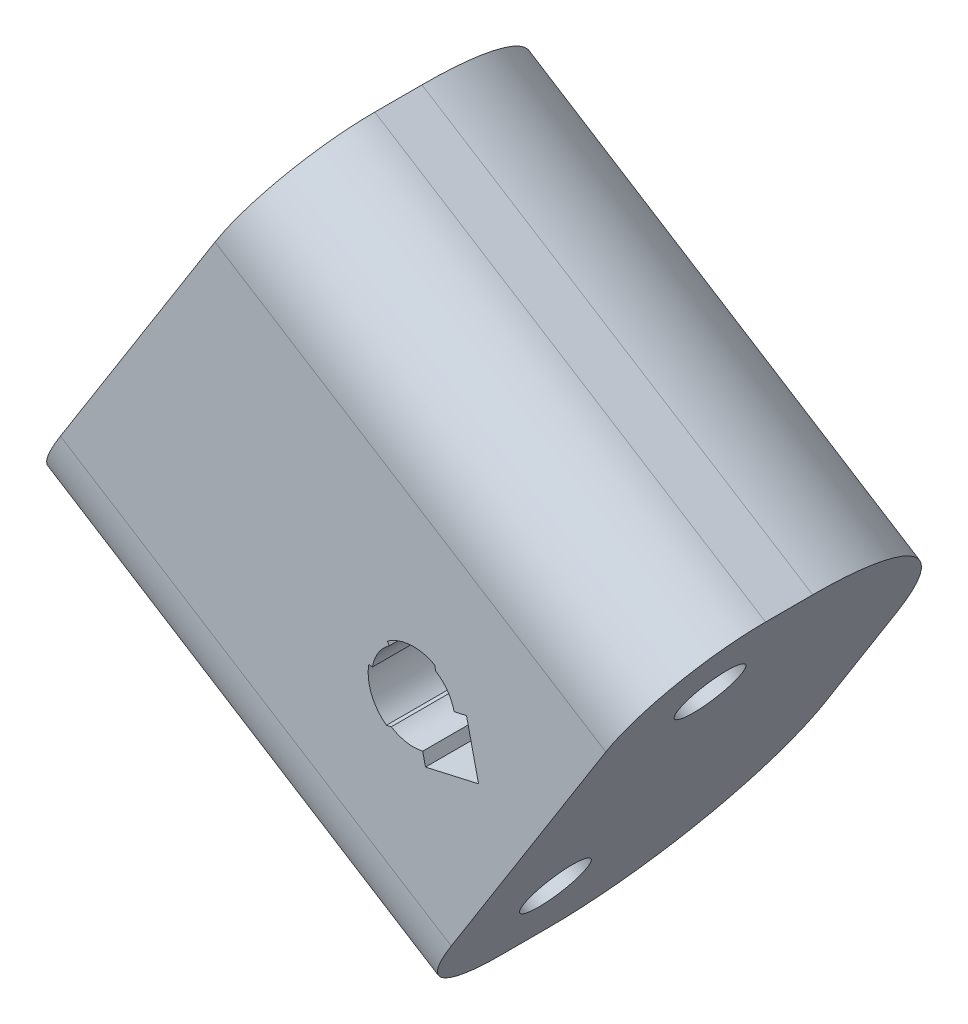
from build123d import *

# Parameters (mm, degrees)
SKETCH1_R           = 1.75
BOSS_EXTRUDE1_DEPTH = 15.478309227
SKETCH2_R           = 1.75
BOSS_EXTRUDE2_DEPTH = 10
SKETCH5_W           = 2.4
SKETCH5_H           = 27.5
CUT_EXTRUDE1_DEPTH  = 15.478309227
CUT_EXTRUDE2_DEPTH  = 18.35
FILLET1_R           = 10
CHAMFER1_SIZE       = 0.2


with BuildPart() as part:
    # Sketch1 → Boss-Extrude1 (new body)
    with BuildSketch(Plane(origin=(-2.115260895, 1.332543188, 0), x_dir=(0, 0, -1), z_dir=(0.8461043578704047, -0.533017275135347, 0))):
        with BuildLine():
            Line((16.124998711, 13.75), (1.124998711, 13.75))
            ThreePointArc((1.124998711, 13.75), (-2.94086528, 12.065863992), (-4.625001289, 8))
            Line((-4.625001289, 8), (-4.625001289, -8))
            ThreePointArc((-4.625001289, -8), (-2.94086528, -12.065863992), (1.124998711, -13.75))
            Line((1.124998711, -13.75), (16.124998711, -13.75))
            Line((16.124998711, -13.75), (16.124998711, 13.75))
        make_face()
        with Locations(Location((1.124998711, 8, 0), (0, 0, 90))):
            Circle(SKETCH1_R, mode=Mode.SUBTRACT)
        with Locations(Location((1.124998711, -8, 0), (0, 0, 90))):
            Circle(SKETCH1_R, mode=Mode.SUBTRACT)
    extrude(amount=BOSS_EXTRUDE1_DEPTH)

    # Sketch2 → Boss-Extrude2 (add)
    with BuildSketch(Plane(origin=(10.981003995, -6.91766302, 0), x_dir=(0, 0, -1), z_dir=(0.8461043578704048, -0.5330172751353467, 0))):
        with BuildLine():
            ThreePointArc((-4.625001289, -8), (-2.94086528, -12.065863992), (1.124998711, -13.75))
            Line((1.124998711, -13.75), (13.724998711, -13.75))
            Line((13.724998711, -13.75), (13.724998711, -2.9))
            Line((13.724998711, -2.9), (13.724998711, 0))
            Line((13.724998711, 0), (13.724998711, 2.9))
            Line((13.724998711, 2.9), (13.724998711, 13.75))
            Line((13.724998711, 13.75), (1.124998711, 13.75))
            ThreePointArc((1.124998711, 13.75), (-2.94086528, 12.065863992), (-4.625001289, 8))
            Line((-4.625001289, 8), (-4.625001289, -8))
        make_face()
        with Locations((1.124998711, -8)):
            Circle(SKETCH2_R, mode=Mode.SUBTRACT)
        with Locations((1.124998711, 8)):
            Circle(SKETCH2_R, mode=Mode.SUBTRACT)
    extrude(amount=BOSS_EXTRUDE2_DEPTH)

    # Sketch5 → Cut-Extrude1 (cut)
    with BuildSketch(Plane(origin=(10.981003995, -6.91766302, 0), x_dir=(0, 0, -1), z_dir=(0.8461043578704048, -0.5330172751353467, 0))):
        with Locations((14.924998711, 0)):
            Rectangle(SKETCH5_W, SKETCH5_H)
    extrude(amount=-CUT_EXTRUDE1_DEPTH, mode=Mode.SUBTRACT)

    # Sketch7 → Cut-Extrude2 (cut)
    with BuildSketch(Plane(origin=(0, 0, -13.724998711), x_dir=(-1, 0, 0), z_dir=(0, 0, -1))):
        with BuildLine():
            Line((-16.021823666, -7.58604821), (-16.685981664, -10.511606986))
            Line((-16.685981664, -10.511606986), (-13.760422887, -11.175764984))
            ThreePointArc((-13.760422887, -11.175764984), (-15.634577963, -9.849258033), (-16.021823666, -7.58604821))
        make_face()
        with BuildLine():
            ThreePointArc((-16.021823666, -7.58604821), (-15.634577963, -9.849258033), (-13.760422887, -11.175764984))
            Line((-13.760422887, -11.175764984), (-13.649729888, -10.688171855))
            ThreePointArc((-13.649729888, -10.688171855), (-15.211525784, -9.582749396), (-15.534230536, -7.69674121))
            Line((-15.534230536, -7.69674121), (-16.021823666, -7.58604821))
        make_face()
        with BuildLine():
            ThreePointArc((-15.534230536, -7.69674121), (-15.211525784, -9.582749396), (-13.649729888, -10.688171855))
            Line((-13.649729888, -10.688171855), (-13.605452688, -10.493134603))
            ThreePointArc((-13.605452688, -10.493134603), (-15.042304913, -9.476145941), (-15.339193285, -7.741018409))
            Line((-15.339193285, -7.741018409), (-15.534230536, -7.69674121))
        make_face()
        with BuildLine():
            ThreePointArc((-15.339193285, -7.741018409), (-15.042304913, -9.476145941), (-13.605452688, -10.493134603))
            Line((-13.605452688, -10.493134603), (-13.096264889, -8.250206208))
            Line((-13.096264889, -8.250206208), (-15.339193285, -7.741018409))
        make_face()
        with BuildLine():
            Line((-13.096264889, -8.250206208), (-13.605452688, -10.493134603))
            ThreePointArc((-13.605452688, -10.493134603), (-12.708361538, -10.517259579), (-11.870325157, -10.196246231))
            Line((-11.870325157, -10.196246231), (-13.096264889, -8.250206208))
        make_face()
        with BuildLine():
            ThreePointArc((-14.322204622, -6.304166185), (-14.973602792, -6.921446486), (-15.339193285, -7.741018409))
            Line((-15.339193285, -7.741018409), (-13.096264889, -8.250206208))
            Line((-13.096264889, -8.250206208), (-14.322204622, -6.304166185))
        make_face()
        with BuildLine():
            Line((-10.829211518, -7.862302856), (-13.096264889, -8.250206208))
            Line((-13.096264889, -8.250206208), (-11.870325157, -10.196246231))
            ThreePointArc((-11.870325157, -10.196246231), (-11.082603872, -9.361587919), (-10.796264889, -8.250206208))
            ThreePointArc((-10.796264889, -8.250206208), (-10.804516348, -8.055556207), (-10.829211518, -7.862302856))
        make_face()
        with BuildLine():
            Line((-11.870325157, -10.196246231), (-11.763721702, -10.365467103))
            ThreePointArc((-11.763721702, -10.365467103), (-10.907502914, -9.458229807), (-10.596264889, -8.250206208))
            ThreePointArc((-10.596264889, -8.250206208), (-10.605233866, -8.038630121), (-10.632076442, -7.82857213))
            Line((-10.632076442, -7.82857213), (-10.829211518, -7.862302856))
            ThreePointArc((-10.829211518, -7.862302856), (-10.804516348, -8.055556207), (-10.796264889, -8.250206208))
            ThreePointArc((-10.796264889, -8.250206208), (-11.082603872, -9.361587919), (-11.870325157, -10.196246231))
        make_face()
        with BuildLine():
            Line((-14.322204622, -6.304166185), (-13.096264889, -8.250206208))
            Line((-13.096264889, -8.250206208), (-11.767505167, -6.372868305))
            ThreePointArc((-11.767505167, -6.372868305), (-13.034434615, -5.951037441), (-14.322204622, -6.304166185))
        make_face()
        with BuildLine():
            ThreePointArc((-11.651960844, -6.209621531), (-13.029058069, -5.751109722), (-14.428808077, -6.134945313))
            Line((-14.428808077, -6.134945313), (-14.322204622, -6.304166185))
            ThreePointArc((-14.322204622, -6.304166185), (-13.034434615, -5.951037441), (-11.767505167, -6.372868305))
            Line((-11.767505167, -6.372868305), (-11.651960844, -6.209621531))
        make_face()
        with BuildLine():
            Line((-11.767505167, -6.372868305), (-13.096264889, -8.250206208))
            Line((-13.096264889, -8.250206208), (-10.829211518, -7.862302856))
            ThreePointArc((-10.829211518, -7.862302856), (-11.150224866, -7.024266475), (-11.767505167, -6.372868305))
        make_face()
    extrude(amount=-CUT_EXTRUDE2_DEPTH, mode=Mode.SUBTRACT)

    # Fillet1
    fillet1_edges = [part.edges().sort_by_distance(p)[0] for p in [
        (1.334405806, -17.091581212, -13.724998711),
        (15.992380872, 6.176288629, -13.724998711),
    ]]
    fillet(fillet1_edges, radius=FILLET1_R)

    # Chamfer1
    # the kernel refuses this chamfer: 0.2 mm, written as the material it adds along each edge
    with BuildSketch(Plane(origin=(14.428808077, -6.134945313, -13.724998711), x_dir=(-0.533017275135546, -0.8461043578702794, 0), z_dir=(0, 0, 1))) as chamfer1_piece_1_section:
        with BuildLine():
            Line((CHAMFER1_SIZE, 0), (0.007427842, -0.192572158))
            ThreePointArc((0.007427842, -0.192572158), (0.001963813, -0.09907174), (0, 0))
            Line((0, 0), (CHAMFER1_SIZE, 0))
        make_face()
    chamfer1_piece_1 = extrude(amount=18.35, mode=Mode.PRIVATE)
    chamfer1_piece_1 = chamfer1_piece_1 - Plane(origin=(13.096264889, -8.250206208, -13.724998711), x_dir=(0.5330172751353905, 0.8461043578703773, 0), z_dir=(0, 0, -1)) * Cylinder(2.3, 38, mode=Mode.PRIVATE)
    add(chamfer1_piece_1)
    with BuildSketch(Plane(origin=(11.763721702, -10.365467103, -13.724998711), x_dir=(-0.8249315284266814, 0.5652326719215895, 0), z_dir=(0, 0, 1))) as chamfer1_piece_2_section:
        with BuildLine():
            Line((0.192715357, 0), (CHAMFER1_SIZE * 0.0385430714682, -CHAMFER1_SIZE * 0.999256939752))
            Line((CHAMFER1_SIZE * 0.0385430714682, -CHAMFER1_SIZE * 0.999256939752), (0, 0))
            ThreePointArc((0, 0), (0.099073815, 0.001856175), (0.192715357, 0))
        make_face()
    chamfer1_piece_2 = extrude(amount=18.35, mode=Mode.PRIVATE)
    chamfer1_piece_2 = chamfer1_piece_2 - Plane(origin=(13.096264889, -8.250206208, -13.724998711), x_dir=(0.22138599930385242, -0.9751862587794369, 0), z_dir=(0, 0, -1)) * Cylinder(2.3, 38, mode=Mode.PRIVATE)
    add(chamfer1_piece_2)


solid = part.part
